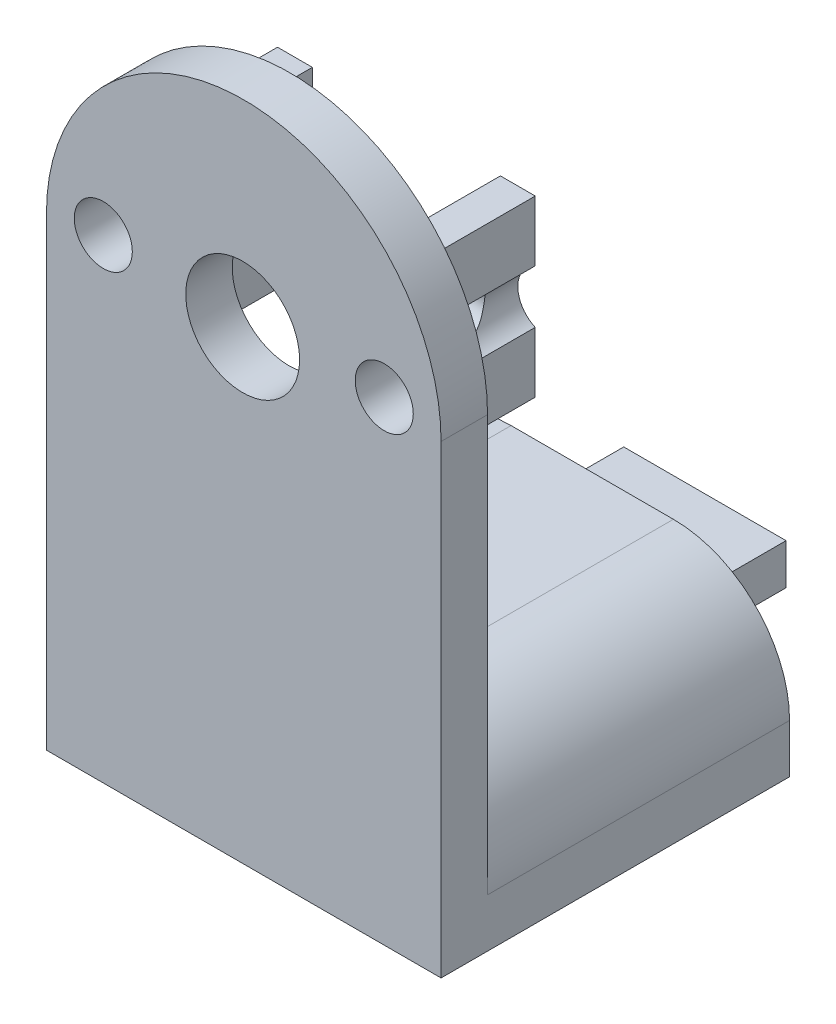
from build123d import *
from build123d.topology import SkipClean

# Parameters (mm, degrees)
BOSS_EXTRUDE1_DEPTH      = 11
BOSS_EXTRUDE1_DEPTH_BACK = 3.2
SKETCH1_W                = 33.974254959
SKETCH1_H                = 30
BOSS_EXTRUDE2_DEPTH      = 9.7
SKETCH13_R               = 4.9
BOSS_EXTRUDE6_DEPTH      = 4
BOSS_EXTRUDE7_DEPTH      = 10
CUT_EXTRUDE4_REACH       = 71.333
SKETCH14_5_R             = 2.5
CUT_EXTRUDE5_DEPTH       = 64.611129818
CUT_EXTRUDE5_DEPTH_BACK  = 64.611129818
SKETCH15_R               = 1.75
FILLET3_R                = 10


with BuildPart() as part:
    # Sketch1 → Boss-Extrude1 (new, two sides: drawn at the far end of the back side and taken through both)
    with BuildSketch(Plane(origin=(0, 0, 0), x_dir=(1, 0, 0), z_dir=(0, 1, 0)).offset(-BOSS_EXTRUDE1_DEPTH_BACK)):
        with Locations((-8.300819215, -7.897016229)):
            Rectangle(SKETCH1_W, SKETCH1_H)
    extrude(amount=BOSS_EXTRUDE1_DEPTH + BOSS_EXTRUDE1_DEPTH_BACK)

    # Sketch2 → Boss-Extrude2 (add)
    with BuildSketch(Plane(origin=(0, 0, -7.102983771), x_dir=(-1, 0, 0), z_dir=(0, 0, -1))):
        Polygon((8.300819214, 4.557110743), (1.313691735, 4.557110743), (1.313691735, 1.043971306), (15.287946694, 1.043971306), (15.287946694, 4.557110743), align=None)
    extrude(amount=BOSS_EXTRUDE2_DEPTH)

    # Sketch13 → Boss-Extrude6 (add)
    with BuildSketch(Plane.XY.offset(22.897016229)):
        with BuildLine():
            Line((-25.287946694, 11), (8.686308265, 11))
            Line((8.686308265, 11), (8.686308265, 36.8))
            ThreePointArc((8.686308265, 36.8), (-8.300819214, 53.787127479), (-25.287946694, 36.8))
            Line((-25.287946694, 36.8), (-25.287946694, 11))
        make_face()
        with Locations((-8.394509147, 36.8)):
            Circle(SKETCH13_R, mode=Mode.SUBTRACT)
    extrude(amount=-BOSS_EXTRUDE6_DEPTH)

    # Sketch14 → Boss-Extrude7 (add)
    with BuildSketch(Plane(origin=(0, 0, 18.897016229), x_dir=(-1, 0, 0), z_dir=(0, 0, -1))):
        with BuildLine():
            Line((19.394509147, 45.155290068), (16.394509147, 45.155290068))
            Line((16.394509147, 45.155290068), (16.394509147, 30.155290068))
            Line((16.394509147, 30.155290068), (19.394509147, 30.155290068))
            Line((19.394509147, 30.155290068), (19.394509147, 35.36400222))
            ThreePointArc((19.394509147, 35.36400222), (17.894509147, 37.655290068), (19.394509147, 39.946577915))
            Line((19.394509147, 39.946577915), (19.394509147, 45.155290068))
        make_face()
    boss_extrude7 = extrude(amount=BOSS_EXTRUDE7_DEPTH)

    # Sketch14<5> → Cut-Extrude4 (cut, up to next)
    with BuildSketch(Plane(origin=(0, 0, 18.897016229), x_dir=(-1, 0, 0), z_dir=(0, 0, -1)), mode=Mode.PRIVATE) as cut_extrude4_sk1:
        with Locations((20.394509147, 37.655290068)):
            Circle(SKETCH14_5_R)
    cut_extrude4_tool1 = extrude(cut_extrude4_sk1.sketch, amount=-CUT_EXTRUDE4_REACH, mode=Mode.PRIVATE) & part.part
    cut_extrude4 = cut_extrude4_tool1.solids().sort_by_distance((-20.394509, 37.65529, 18.897016))[0]
    add(cut_extrude4, mode=Mode.SUBTRACT)

    # Mirror1: Boss-Extrude7, Cut-Extrude4 across plane
    with SkipClean():  # the faces are left unmerged after this step: merging them gives an invalid solid
        add(boss_extrude7.mirror(Plane.ZY.offset(8.300819214)))
        add(cut_extrude4.mirror(Plane.ZY.offset(8.300819214)), mode=Mode.SUBTRACT)

    # Sketch15 → Cut-Extrude5 (cut, two sides: drawn at the far end of the back side and taken through both)
    with SkipClean():  # the faces are left unmerged after this step: merging them gives an invalid solid
        with BuildSketch(Plane(origin=(-16.394509147, 0, 0), x_dir=(0, 0, -1), z_dir=(1, 0, 0)).offset(-CUT_EXTRUDE5_DEPTH_BACK)):
            with Locations((-13.558051203, 38.023895041)):
                Circle(SKETCH15_R)
        extrude(amount=CUT_EXTRUDE5_DEPTH + CUT_EXTRUDE5_DEPTH_BACK, mode=Mode.SUBTRACT)

    # Fillet3
    fillet3_edges = [part.edges().sort_by_distance(p)[0] for p in [
        (-25.287946694, 11, 5.897016229),
        (8.686308265, 11, 5.897016229),
    ]]
    fillet(fillet3_edges, radius=FILLET3_R)


solid = part.part
